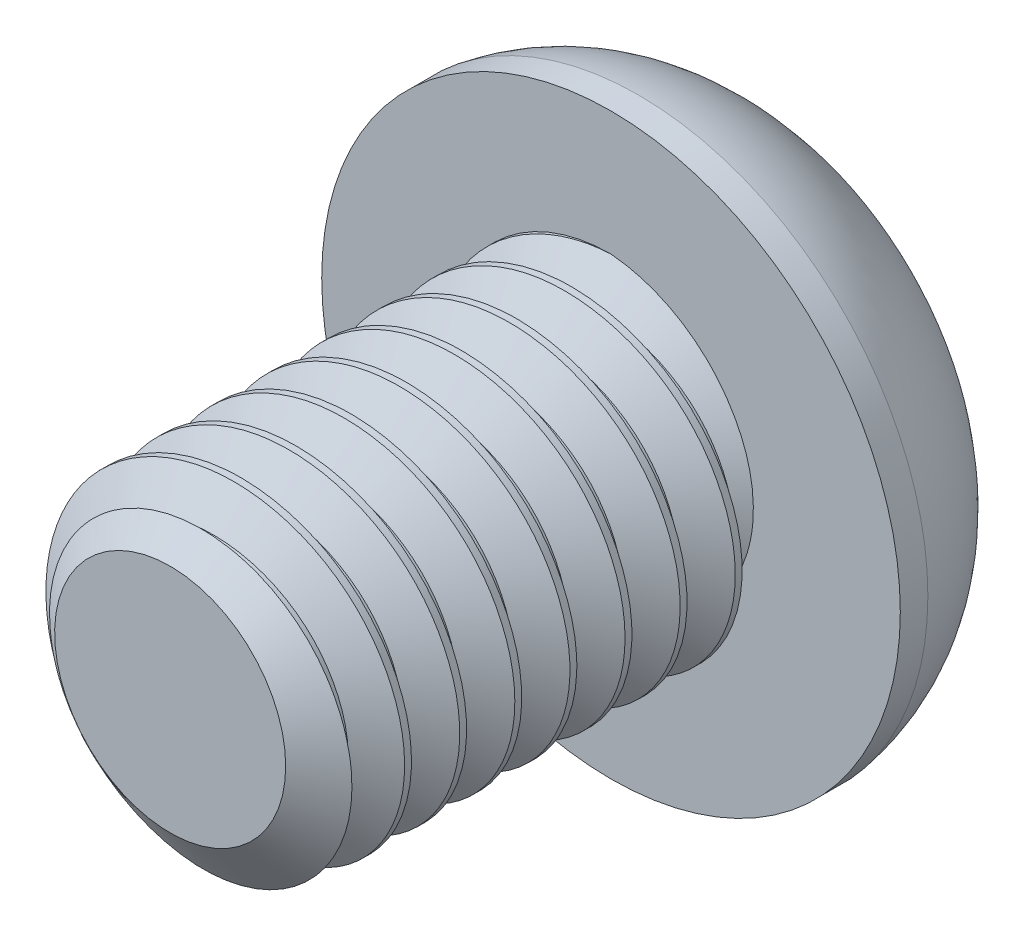
from build123d import *

# Parameters (mm, degrees)
SKETCH1_R          = 3
EXTRUDE1_DEPTH     = 8
CUT_SWEEP1_PITCH   = 1
SKETCH6_R          = 5.25
EXTRUDE2_DEPTH     = 3.3
CUT_EXTRUDE1_DEPTH = 3
SKETCH8_R          = 2.309401077
CUT_EXTRUDE2_DEPTH = 14.520909894
CUT_EXTRUDE2_TAPER = 45


with BuildPart() as part:
    # Sketch1 → Extrude1 (new body)
    with BuildSketch(Plane.XY):
        Circle(SKETCH1_R)
    extrude(amount=-EXTRUDE1_DEPTH)

    # Cut-Sweep1: the profile of Sketch3 profile screwed along a right-hand helix of 9 turns, 6 arcs to a turn; built about Z, then put on its axis
    cut_sweep1_z = Axis((0, 0, 0), (0, 0, 1))
    cut_sweep1_corners = [(3.0003, 0, -0.875173205), (2.350480947, 0, -0.5), (2.350480947, 0, -0.375), (3.0003, 0, 0.000173205)]
    with BuildLine(mode=Mode.PRIVATE) as cut_sweep1_profile:
        Line(cut_sweep1_corners[0], cut_sweep1_corners[1])
        Line(cut_sweep1_corners[1], cut_sweep1_corners[2])
        Line(cut_sweep1_corners[2], cut_sweep1_corners[3])
        Line(cut_sweep1_corners[3], cut_sweep1_corners[0])
    cut_sweep1_cap = Face(cut_sweep1_profile.wire())
    cut_sweep1_turn_angles = [0, 30, 60, 90, 120, 150, 180, 210, 240, 270, 300, 330, 360]
    cut_sweep1_turn_weights = [1, 0.8660254037844387, 1, 0.8660254037844387, 1, 0.8660254037844387, 1, 0.8660254037844387, 1, 0.8660254037844387, 1, 0.8660254037844387, 1]
    cut_sweep1_turn_rails = [Edge.make_bspline([Vector(p[0], p[1], 0).rotate(cut_sweep1_z, cut_sweep1_turn_angles[k]) / cut_sweep1_turn_weights[k] + Vector(0, 0, p[2] + CUT_SWEEP1_PITCH * cut_sweep1_turn_angles[k] / 360) for k in range(13)], [0, 0, 0, 1, 1, 2, 2, 3, 3, 4, 4, 5, 5, 6, 6, 6], 2, cut_sweep1_turn_weights) for p in cut_sweep1_corners]
    cut_sweep1_turn_sides = [Face.make_surface_from_curves(cut_sweep1_turn_rails[p[0]], cut_sweep1_turn_rails[p[1]]) for p in [(0, 1), (1, 2), (2, 3), (3, 0)]]
    cut_sweep1 = Plane(origin=(0, 0, 0), x_dir=(0, 1, 0), z_dir=(0, 0, -1)) * Solid(Shell([*[p.moved(Location((0, 0, CUT_SWEEP1_PITCH * i))) for i in range(9) for p in cut_sweep1_turn_sides], cut_sweep1_cap, cut_sweep1_cap.rotate(cut_sweep1_z, 3240).moved(Location((0, 0, CUT_SWEEP1_PITCH * 3240 / 360)))]))
    add(cut_sweep1, mode=Mode.SUBTRACT)

    # Sketch4 → Cut-Revolve1 (revolve, cut)
    with BuildSketch(Plane(origin=(0, 0, 0), x_dir=(0, 0, -1), z_dir=(1, 0, 0)), mode=Mode.PRIVATE) as cut_revolve1_sk:
        Polygon((0.632650852, 3), (0, 2.096480947), (0, 3), align=None)
    revolve(cut_revolve1_sk.sketch.rotate(Axis((0, 0, 0), (0, 0, -1)), 244.349292568), axis=Axis((0, 0, 0), (0, 0, -1)), mode=Mode.SUBTRACT)

    # Sketch6 → Extrude2 (add)
    with BuildSketch(Plane(origin=(0, 0, -8), x_dir=(-1, 0, 0), z_dir=(0, 0, -1))):
        Circle(SKETCH6_R)
    extrude(amount=EXTRUDE2_DEPTH)

    # Sketch10 → Cut-Revolve2 (revolve, cut)
    with BuildSketch(Plane(origin=(0, 0, 0), x_dir=(0, 0, -1), z_dir=(1, 0, 0)), mode=Mode.PRIVATE) as cut_revolve2_sk:
        with BuildLine():
            Line((8.5, 5.25), (8.5, 5.75))
            Line((8.5, 5.75), (11.8, 5.75))
            Line((11.8, 5.75), (11.8, 2))
            Line((11.8, 2), (11.3, 2))
            ThreePointArc((11.3, 2), (10.503463201, 4.144906758), (8.5, 5.25))
        make_face()
    revolve(cut_revolve2_sk.sketch.rotate(Axis((0, 0, 0), (0, 0, -1)), 90), axis=Axis((0, 0, 0), (0, 0, -1)), mode=Mode.SUBTRACT)

    # Sketch7 → Cut-Extrude1 (cut)
    with BuildSketch(Plane(origin=(0, 0, -11.3), x_dir=(-1, 0, 0), z_dir=(0, 0, -1))):
        Polygon((0, 2.309401077), (-2, 1.154700538), (-2, -1.154700538), (0, -2.309401077), (2, -1.154700538), (2, 1.154700538), align=None)
    extrude(amount=-CUT_EXTRUDE1_DEPTH, mode=Mode.SUBTRACT)

    # Sketch8 → Cut-Extrude2 (cut, through all)
    with BuildSketch(Plane.XY.offset(-11.3)):
        Circle(SKETCH8_R)
    extrude(amount=CUT_EXTRUDE2_DEPTH, taper=CUT_EXTRUDE2_TAPER, mode=Mode.SUBTRACT)


solid = part.part
